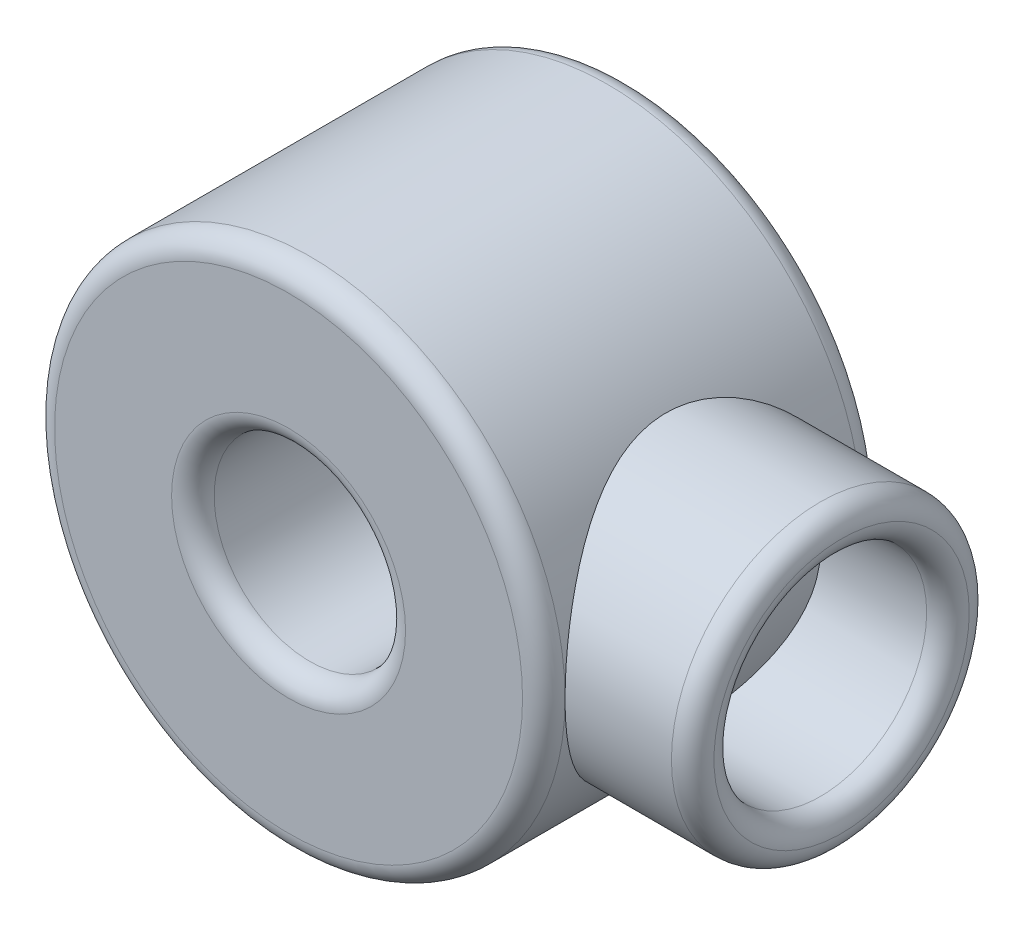
from build123d import *

# Parameters (mm, degrees)
SKETCH1_R                = 38.1
SKETCH1_R_2              = 14.2875
BOSS_EXTRUDE1_DEPTH      = 25.4
BOSS_EXTRUDE2_DEPTH      = 25.4
BOSS_EXTRUDE2_DEPTH_BACK = 2.54
SKETCH2_R                = 22.225
SKETCH2_R_2              = 15.875
FILLET1_R                = 3.175


with BuildPart() as part:
    # Sketch1 → Boss-Extrude1 (new, symmetric)
    with BuildSketch(Plane.XY):
        Circle(SKETCH1_R)
        Circle(SKETCH1_R_2, mode=Mode.SUBTRACT)
    extrude(amount=BOSS_EXTRUDE1_DEPTH, both=True)

    # Sketch2 → Boss-Extrude2 (add, two sides: drawn at the far end of the back side and taken through both)
    with BuildSketch(Plane(origin=(31.75, 0, 0), x_dir=(0, 0, -1), z_dir=(1, 0, 0)).offset(-BOSS_EXTRUDE2_DEPTH_BACK)):
        Circle(SKETCH2_R)
        Circle(SKETCH2_R_2, mode=Mode.SUBTRACT)
    extrude(amount=BOSS_EXTRUDE2_DEPTH + BOSS_EXTRUDE2_DEPTH_BACK)

    # Fillet1
    fillet1_edges = [part.edges().sort_by_distance(p)[0] for p in [
        (57.15, 0, 15.875),
        (57.15, 0, 22.225),
        (-38.1, 0, -25.4),
        (-38.1, 0, 25.4),
        (-14.2875, 0, -25.4),
        (-14.2875, 0, 25.4),
    ]]
    fillet(fillet1_edges, radius=FILLET1_R - 0.0001)  # a hair under: the kernel refuses the full size


solid = part.part
